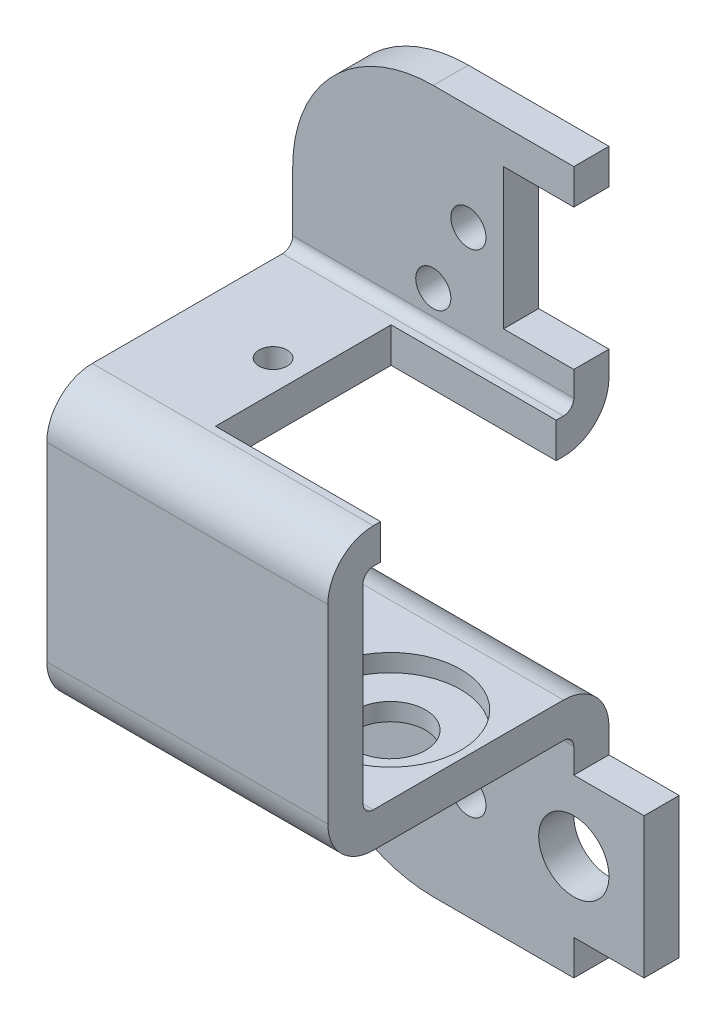
from build123d import *

# Parameters (mm, degrees)
SKETCH1_W           = 40
SKETCH1_H           = 50
SKETCH1_R           = 1.25
BASE_FLANGE1_DEPTH  = 2.5
SKETCH15_R          = 1
CUT_EXTRUDE3_DEPTH  = 10
JOG3_START          = -2.5
JOG3_OUTLINE_W      = 40
JOG3_OUTLINE_H      = 48.294687966
JOG3_OUTLINE_R      = 1
JOG3_OUTLINE_R_2    = 1.25
JOG3_DEPTH          = 2.5
JOG3_2_OUTLINE_W    = 40
JOG3_2_OUTLINE_H    = 1.705312034
JOG3_2_DEPTH        = 0.332528284
JOG3_START_2        = 14.2634
JOG3_3_OUTLINE_W    = 40
JOG3_3_OUTLINE_H    = 35
JOG3_3_OUTLINE_R    = 1
JOG3_3_OUTLINE_R_2  = 1.25
JOG3_3_DEPTH        = 3.2366
JOG3_4_OUTLINE_W    = 40
JOG3_4_OUTLINE_H    = 15.794687966
JOG3_4_OUTLINE_R    = 1.25
JOG3_4_DEPTH        = 3.2366
JOG3_5_OUTLINE_W    = 40
JOG3_5_OUTLINE_H    = 2.5
JOG3_5_DEPTH        = 15
JOG3_START_3        = 15
JOG3_6_OUTLINE_R    = 1.25
JOG3_6_OUTLINE_R_2  = 1
JOG3_6_DEPTH        = 2.5
JOG3_START_4        = -20
JOG3_7_DEPTH        = 40
JOG4_START          = -20
JOG4_DEPTH          = 40
JOG4_2_DEPTH        = 40
JOG4_START_2        = -3
JOG4_3_OUTLINE_R    = 1.25
JOG4_3_DEPTH        = 4
FILLET1_R           = 10
SKETCH18_R          = 2.5
BOSS_EXTRUDE1_DEPTH = 2.5
SKETCH19_R          = 1
SKETCH19_W          = 23.5
SKETCH19_H          = 12.5
CUT_EXTRUDE4_DEPTH  = 2.5
SKETCH20_R          = 2.5
SKETCH20_R_2        = 1.25
CUT_EXTRUDE6_DEPTH  = 10
SKETCH23_R          = 2.5
CUT_EXTRUDE7_DEPTH  = 44.945989578
SKETCH24_R          = 5
CUT_EXTRUDE8_DEPTH  = 1.25
SKETCH25_W          = 20
SKETCH25_H          = 13.5268
CUT_EXTRUDE11_DEPTH = 50.640775238


with BuildPart() as part:
    # Base-Flange1: sheet metal written as solids
    # Sketch1 → Base-Flange1 (new body)
    with BuildSketch(Plane.XY):
        Rectangle(SKETCH1_W, SKETCH1_H)
        with Locations((10, 12.5)):
            Circle(SKETCH1_R, mode=Mode.SUBTRACT)
        with Locations(Location((10, -12.5, 0), (0, 0, 180))):
            Circle(SKETCH1_R, mode=Mode.SUBTRACT)
        with Locations((-10, -12.5)):
            Circle(SKETCH1_R, mode=Mode.SUBTRACT)
        with Locations(Location((-10, 12.5, 0), (0, 0, 180))):
            Circle(SKETCH1_R, mode=Mode.SUBTRACT)
    extrude(amount=-BASE_FLANGE1_DEPTH)

    # Sketch15 → Cut-Extrude3 (cut)
    with BuildSketch(Plane.XY):
        with Locations((12, 0)):
            Circle(SKETCH15_R)
        with Locations(Location((-17, 0, 0), (0, 0, 180))):
            Circle(SKETCH15_R)
    extrude(amount=-CUT_EXTRUDE3_DEPTH, mode=Mode.SUBTRACT)

    # Jog3: read off the stored shape, not the designer's step
    # Jog3 outline → Jog3 (cut)
    with BuildSketch(Plane.XY.offset(JOG3_START)):
        with Locations((0, -0.852656017)):
            Rectangle(JOG3_OUTLINE_W, JOG3_OUTLINE_H)
        with Locations((-17, 0)):
            Circle(JOG3_OUTLINE_R, mode=Mode.SUBTRACT)
        with Locations((12, 0)):
            Circle(JOG3_OUTLINE_R, mode=Mode.SUBTRACT)
        with Locations((-10, 12.5)):
            Circle(JOG3_OUTLINE_R_2, mode=Mode.SUBTRACT)
        with Locations((10, 12.5)):
            Circle(JOG3_OUTLINE_R_2, mode=Mode.SUBTRACT)
        with Locations((10, -12.5)):
            Circle(JOG3_OUTLINE_R_2, mode=Mode.SUBTRACT)
        with Locations((-10, -12.5)):
            Circle(JOG3_OUTLINE_R_2, mode=Mode.SUBTRACT)
    extrude(amount=JOG3_DEPTH, mode=Mode.SUBTRACT)

    # Jog3 2 outline → Jog3 2 (cut)
    with BuildSketch(Plane.XY.offset(JOG3_START)):
        with Locations((0, 24.147343983)):
            Rectangle(JOG3_2_OUTLINE_W, JOG3_2_OUTLINE_H)
    extrude(amount=JOG3_2_DEPTH, mode=Mode.SUBTRACT)

    # Jog3 4 outline → Jog3 4 (add)
    with BuildSketch(Plane.XY.offset(JOG3_START)):
        with Locations((0, 32.897343983)):
            Rectangle(JOG3_4_OUTLINE_W, JOG3_4_OUTLINE_H)
        with Locations((10, 28.294687966)):
            Circle(JOG3_4_OUTLINE_R, mode=Mode.SUBTRACT)
        with Locations((-10, 28.294687966)):
            Circle(JOG3_4_OUTLINE_R, mode=Mode.SUBTRACT)
    extrude(amount=JOG3_4_DEPTH)



with BuildPart() as body_2:
    # Jog3 3 outline → Jog3 3 (new body)
    with BuildSketch(Plane.XY.offset(JOG3_START_2)):
        with Locations((0, 8.294687966)):
            Rectangle(JOG3_3_OUTLINE_W, JOG3_3_OUTLINE_H)
        with Locations((12, 15.794687966)):
            Circle(JOG3_3_OUTLINE_R, mode=Mode.SUBTRACT)
        with Locations((-17, 0)):
            Circle(JOG3_3_OUTLINE_R, mode=Mode.SUBTRACT)
        with Locations((-10, 3.294687966)):
            Circle(JOG3_3_OUTLINE_R_2, mode=Mode.SUBTRACT)
        with Locations((12, 0)):
            Circle(JOG3_3_OUTLINE_R, mode=Mode.SUBTRACT)
        with Locations((10, 3.294687966)):
            Circle(JOG3_3_OUTLINE_R_2, mode=Mode.SUBTRACT)
        with Locations((-17, 15.794687966)):
            Circle(JOG3_3_OUTLINE_R, mode=Mode.SUBTRACT)
        with Locations((-10, 12.5)):
            Circle(JOG3_3_OUTLINE_R_2, mode=Mode.SUBTRACT)
        with Locations((10, 12.5)):
            Circle(JOG3_3_OUTLINE_R_2, mode=Mode.SUBTRACT)
    extrude(amount=JOG3_3_DEPTH)


with BuildPart() as part_1:
    add(part.part)

    add(body_2.part)  # Jog3 5 merges body 2
    # Jog3 5 outline → Jog3 5 (add)
    with BuildSketch(Plane.XY):
        with Locations((0, 24.544687966)):
            Rectangle(JOG3_5_OUTLINE_W, JOG3_5_OUTLINE_H)
    extrude(amount=JOG3_5_DEPTH)

    # Jog3 6 outline → Jog3 6 (add)
    with BuildSketch(Plane.XY.offset(JOG3_START_3)):
        with Locations((10, 12.5)):
            Circle(JOG3_6_OUTLINE_R)
        with Locations((-10, 12.5)):
            Circle(JOG3_6_OUTLINE_R)
        with Locations((12, 0)):
            Circle(JOG3_6_OUTLINE_R_2)
        with Locations((-17, 0)):
            Circle(JOG3_6_OUTLINE_R_2)
    extrude(amount=JOG3_6_DEPTH)

    # Jog3 7 outline → Jog3 7 (cut)
    with BuildSketch(Plane.YZ.offset(JOG3_START_4)):
        with BuildLine():
            ThreePointArc((23.294687966, 14.2634), (23.078942821, 14.784254855), (22.558087966, 15))
            Line((22.558087966, 15), (-9.205312034, 15))
            Line((-9.205312034, 15), (-9.205312034, 14.2634))
            Line((-9.205312034, 14.2634), (23.294687966, 14.2634))
        make_face()
        with BuildLine():
            ThreePointArc((26.531287966, -2.5), (24.242666158, -1.552021808), (23.294687966, 0.7366))
            Line((23.294687966, 0.7366), (23.294687966, -2.167471716))
            Line((23.294687966, -2.167471716), (25, -2.167471716))
            Line((25, -2.167471716), (25, -2.5))
            Line((25, -2.5), (26.531287966, -2.5))
        make_face()
        with BuildLine():
            Line((26.531287966, 0), (40.794687966, 0))
            Line((40.794687966, 0), (40.794687966, 0.7366))
            Line((40.794687966, 0.7366), (25.794687966, 0.7366))
            ThreePointArc((25.794687966, 0.7366), (26.010433111, 0.215745145), (26.531287966, 0))
        make_face()
        with BuildLine():
            Line((25.794687966, 17.5), (22.558087966, 17.5))
            ThreePointArc((22.558087966, 17.5), (24.846709774, 16.552021808), (25.794687966, 14.2634))
            Line((25.794687966, 14.2634), (25.794687966, 17.5))
        make_face()
    extrude(amount=JOG3_7_DEPTH, mode=Mode.SUBTRACT)

    # Jog4: read off the stored shape, not the designer's step
    # Jog4 outline → Jog4 (cut)
    with BuildSketch(Plane.YZ.offset(JOG4_START)):
        with BuildLine():
            Line((-9.205312034, 15), (5.87962174, 15))
            ThreePointArc((5.87962174, 15), (7.019882984, 16.799110859), (9.031287966, 17.5))
            Line((9.031287966, 17.5), (-9.205312034, 17.5))
            Line((-9.205312034, 17.5), (-9.205312034, 15))
        make_face()
    extrude(amount=JOG4_DEPTH, mode=Mode.SUBTRACT)

    # Jog4 2 outline → Jog4 2 (add)
    with BuildSketch(Plane.YZ.offset(JOG4_START)):
        with BuildLine():
            Line((-9.205312034, 0), (-9.205312034, -2.5))
            Line((-9.205312034, -2.5), (5.058087966, -2.5))
            ThreePointArc((5.058087966, -2.5), (7.346709774, -1.552021808), (8.294687966, 0.7366))
            Line((8.294687966, 0.7366), (8.294687966, 14.2634))
            ThreePointArc((8.294687966, 14.2634), (8.510433111, 14.784254855), (9.031287966, 15))
            Line((9.031287966, 15), (5.87962174, 15))
            ThreePointArc((5.87962174, 15), (5.81599152, 14.634140241), (5.794687966, 14.2634))
            Line((5.794687966, 14.2634), (5.794687966, 0.7366))
            ThreePointArc((5.794687966, 0.7366), (5.578942821, 0.215745145), (5.058087966, 0))
            Line((5.058087966, 0), (-9.205312034, 0))
        make_face()
    extrude(amount=JOG4_2_DEPTH)

    # Jog4 3 outline → Jog4 3 (cut)
    with BuildSketch(Plane.XY.offset(JOG4_START_2)):
        with Locations((-10, 3.294687966)):
            Circle(JOG4_3_OUTLINE_R)
        with Locations((10, 3.294687966)):
            Circle(JOG4_3_OUTLINE_R)
    extrude(amount=JOG4_3_DEPTH, mode=Mode.SUBTRACT)

    # Fillet1
    fillet1_edges = [part_1.edges().sort_by_distance(p)[0] for p in [
        (20, -9.205312034, -1.25),
        (-20, -9.205312034, -1.25),
        (-20, 40.794687966, -1.25),
        (20, 40.794687966, -1.25),
    ]]
    fillet(fillet1_edges, radius=FILLET1_R)

    # Sketch18 → Boss-Extrude1 (add)
    with BuildSketch(Plane.XY.offset(17.5)):
        with Locations((12, 15.794687966)):
            Circle(SKETCH18_R)
        with Locations((-17, 15.794687966)):
            Circle(SKETCH18_R)
    extrude(amount=-BOSS_EXTRUDE1_DEPTH)

    # Sketch19 → Cut-Extrude4 (cut)
    with BuildSketch(Plane(origin=(0, 25.794687966, 0), x_dir=(1, 0, 0), z_dir=(0, 1, 0))):
        with Locations(Location((13.9, -7.5, 0), (0, 0, 270))):
            Circle(SKETCH19_R)
        with Locations(Location((-13.9, -7.5, 0), (0, 0, 90))):
            Circle(SKETCH19_R)
        with Locations((0, -7.5)):
            Rectangle(SKETCH19_W, SKETCH19_H)
    extrude(amount=-CUT_EXTRUDE4_DEPTH, mode=Mode.SUBTRACT)

    # Sketch20 → Cut-Extrude6 (cut)
    with BuildSketch(Plane.XY):
        with Locations((0, 33.294687966)):
            Circle(SKETCH20_R)
        with Locations(Location((0, -1.705312034, 0), (0, 0, 180))):
            Circle(SKETCH20_R)
        with Locations((7.5, -1.705312034)):
            Circle(SKETCH20_R_2)
        with Locations(Location((-7.5, -1.705312034, 0), (0, 0, 180))):
            Circle(SKETCH20_R_2)
        with Locations(Location((7.5, 33.294687966, 0), (0, 0, 180))):
            Circle(SKETCH20_R_2)
        with Locations((-7.5, 33.294687966)):
            Circle(SKETCH20_R_2)
    extrude(amount=-CUT_EXTRUDE6_DEPTH, mode=Mode.SUBTRACT)

    # Sketch23 → Cut-Extrude7 (cut, through all)
    with BuildSketch(Plane(origin=(0, 25.794687966, 0), x_dir=(1, 0, 0), z_dir=(0, 1, 0))):
        with Locations(Location((-5.55, -7.5, 0), (0, 0, 270))):
            Circle(SKETCH23_R)
    extrude(amount=-CUT_EXTRUDE7_DEPTH, mode=Mode.SUBTRACT)

    # Sketch24 → Cut-Extrude8 (cut)
    with BuildSketch(Plane(origin=(0, 8.294687966, 0), x_dir=(1, 0, 0), z_dir=(0, 1, 0))):
        with Locations(Location((-5.55, -7.5, 0), (0, 0, 270))):
            Circle(SKETCH24_R)
    extrude(amount=-CUT_EXTRUDE8_DEPTH, mode=Mode.SUBTRACT)

    # Sketch25 → Cut-Extrude11 (cut, through all)
    with BuildSketch(Plane.XY.offset(17.5)):
        Polygon((20, 40.794687966), (0, 40.794687966), (0, 38.294687966), (-5, 38.294687966), (-5, 28.294687966), (0, 28.294687966), (0, 22.558087966), (20, 22.558087966), align=None)
        with Locations((10, 15.794687966)):
            Rectangle(SKETCH25_W, SKETCH25_H)
        Polygon((20, -9.205312034), (20, 9.031287966), (0, 9.031287966), (0, 3.294687966), (5, 3.294687966), (5, -6.705312034), (0, -6.705312034), (0, -9.205312034), align=None)
    extrude(amount=-CUT_EXTRUDE11_DEPTH, mode=Mode.SUBTRACT)


solid = part_1.part
